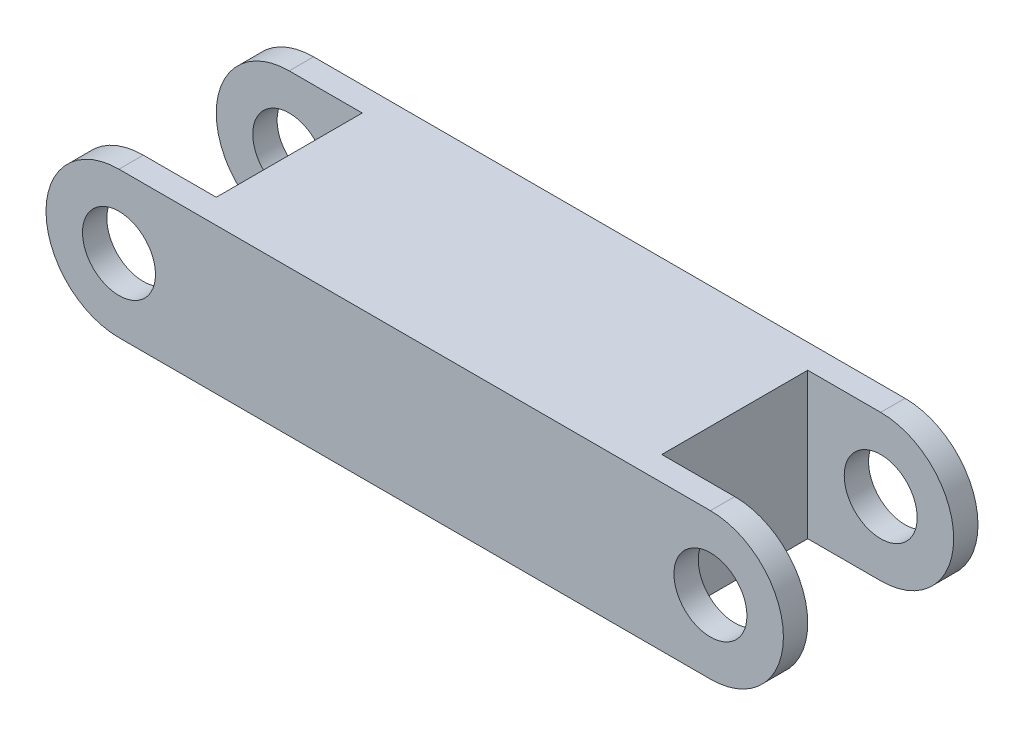
from build123d import *

# Parameters (mm, degrees)
SKETCH1_R           = 7.5
BOSS_EXTRUDE1_DEPTH = 40
SKETCH2_W           = 30
SKETCH2_H           = 30
CUT_EXTRUDE1_DEPTH  = 146.444313452


with BuildPart() as part:
    # Sketch1 → Boss-Extrude1 (new body)
    with BuildSketch(Plane.XY):
        with BuildLine():
            Line((0, 15), (121.579823969, 15))
            ThreePointArc((121.579823969, 15), (136.579823969, 0), (121.579823969, -15))
            Line((121.579823969, -15), (0, -15))
            ThreePointArc((0, -15), (-15, 0), (0, 15))
        make_face()
        Circle(SKETCH1_R, mode=Mode.SUBTRACT)
        with Locations((121.579823969, 0)):
            Circle(SKETCH1_R, mode=Mode.SUBTRACT)
    extrude(amount=BOSS_EXTRUDE1_DEPTH)

    # Sketch2 → Cut-Extrude1 (cut, through all)
    with BuildSketch(Plane(origin=(0, 15, 0), x_dir=(1, 0, 0), z_dir=(0, 1, 0))):
        with Locations((0, -20)):
            Rectangle(SKETCH2_W, SKETCH2_H)
        with Locations((121.579823969, -20)):
            Rectangle(SKETCH2_W, SKETCH2_H)
    extrude(amount=-CUT_EXTRUDE1_DEPTH, mode=Mode.SUBTRACT)


solid = part.part
